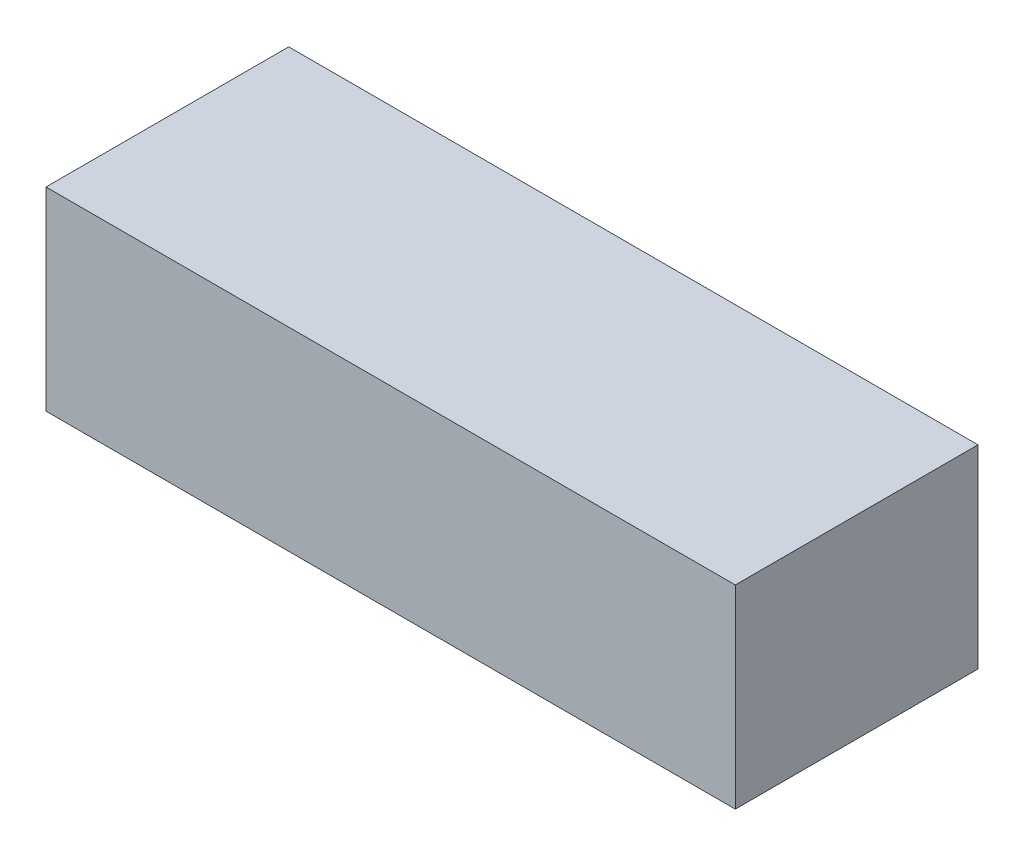
from build123d import *

# Parameters (mm, degrees)
SKETCH1_W           = 35.5
SKETCH1_H           = 12.5
BOSS_EXTRUDE1_DEPTH = 10
SKETCH2_W           = 25.5
SKETCH2_H           = 7.5
CUT_EXTRUDE1_DEPTH  = 7.5
SKETCH4_R           = 1
CUT_EXTRUDE2_DEPTH  = 4


with BuildPart() as part:
    # Sketch1 → Boss-Extrude1 (new body)
    with BuildSketch(Plane(origin=(0, 0, 0), x_dir=(1, 0, 0), z_dir=(0, 1, 0))):
        Rectangle(SKETCH1_W, SKETCH1_H)
    extrude(amount=BOSS_EXTRUDE1_DEPTH)

    # Sketch2 → Cut-Extrude1 (cut)
    with BuildSketch(Plane.XZ):
        with Locations((0, -2.5)):
            Rectangle(SKETCH2_W, SKETCH2_H)
    extrude(amount=-CUT_EXTRUDE1_DEPTH, mode=Mode.SUBTRACT)

    # Sketch4 → Cut-Extrude2 (cut)
    with BuildSketch(Plane(origin=(0, 0, -6.25), x_dir=(-1, 0, 0), z_dir=(0, 0, -1))):
        with Locations((-14.75, 3)):
            Circle(SKETCH4_R)
        with Locations((14.75, 3)):
            Circle(SKETCH4_R)
    extrude(amount=-CUT_EXTRUDE2_DEPTH, mode=Mode.SUBTRACT)


solid = part.part
